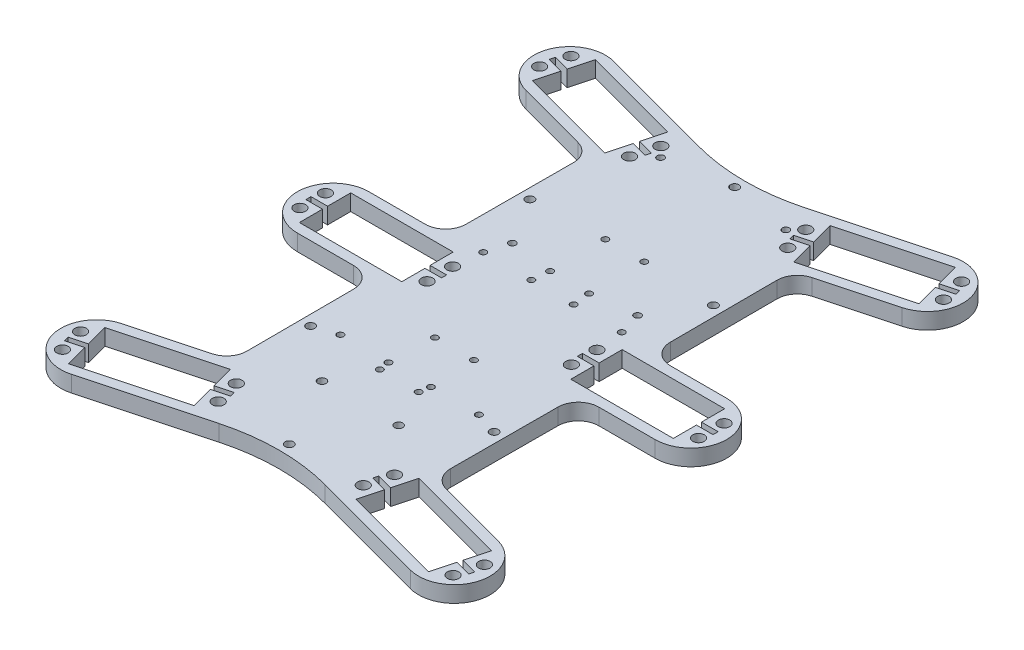
from build123d import *

# Parameters (mm, degrees)
SKETCH1_R           = 2.25
SKETCH1_W           = 40.1
SKETCH1_H           = 20.1
BOSS_EXTRUDE1_DEPTH = 6.35
FILLET1_R           = 80
FILLET2_R           = 8
SKETCH5_W           = 6.5
SKETCH5_H           = 2
CUT_EXTRUDE2_DEPTH  = 136.852736293
SKETCH6_R           = 1.25
SKETCH6_R_2         = 1.35
CUT_EXTRUDE3_DEPTH  = 10
SKETCH7_R           = 1.25
CUT_EXTRUDE4_DEPTH  = 10
SKETCH8_R           = 1.6
CUT_EXTRUDE5_DEPTH  = 10
SKETCH10_R          = 1.65
CUT_EXTRUDE6_DEPTH  = 10


with BuildPart() as part:
    # Sketch1 → Boss-Extrude1 (new body)
    with BuildSketch(Plane(origin=(0, 0, 0), x_dir=(1, 0, 0), z_dir=(0, 1, 0))):
        with BuildLine():
            Line((-70, 14), (-40, 14))
            Line((-40, 14), (-39.816062711, 70))
            Line((-39.816062711, 70), (-73.623466631, 79.058666579))
            ThreePointArc((-73.623466631, 79.058666579), (-83.522961568, 96.205094778), (-66.376533369, 106.104589715))
            Line((-66.376533369, 106.104589715), (0, 88.319051202))
            Line((0, 88.319051202), (66.376533369, 106.104589715))
            ThreePointArc((66.376533369, 106.104589715), (83.522961568, 96.205094778), (73.623466631, 79.058666579))
            Line((73.623466631, 79.058666579), (39.816062711, 70))
            Line((39.816062711, 70), (40, 14))
            Line((40, 14), (70, 14))
            ThreePointArc((70, 14), (84, 0), (70, -14))
            Line((70, -14), (40, -14))
            Line((40, -14), (39.816062711, -70))
            Line((39.816062711, -70), (73.623466631, -79.058666579))
            ThreePointArc((73.623466631, -79.058666579), (83.522961568, -96.205094778), (66.376533369, -106.104589715))
            Line((66.376533369, -106.104589715), (0, -88.319051202))
            Line((0, -88.319051202), (-66.376533369, -106.104589715))
            ThreePointArc((-66.376533369, -106.104589715), (-83.522961568, -96.205094778), (-73.623466631, -79.058666579))
            Line((-73.623466631, -79.058666579), (-39.816062711, -70))
            Line((-39.816062711, -70), (-40, -14))
            Line((-40, -14), (-70, -14))
            ThreePointArc((-70, -14), (-84, 0), (-70, 14))
        make_face()
        with Locations((-76.433311385, 99.481809639)):
            Circle(SKETCH1_R, mode=Mode.SUBTRACT)
        with Locations((-79.021501836, 89.822551376)):
            Circle(SKETCH1_R, mode=Mode.SUBTRACT)
        with Locations((-78, 5)):
            Circle(SKETCH1_R, mode=Mode.SUBTRACT)
        with Locations((-79.021501836, -89.822551376)):
            Circle(SKETCH1_R, mode=Mode.SUBTRACT)
        with Locations((-76.433311385, -99.481809639)):
            Circle(SKETCH1_R, mode=Mode.SUBTRACT)
        with Locations((-78, -5)):
            Circle(SKETCH1_R, mode=Mode.SUBTRACT)
        with Locations((78, -5)):
            Circle(SKETCH1_R, mode=Mode.SUBTRACT)
        with Locations((76.433311385, -99.481809639)):
            Circle(SKETCH1_R, mode=Mode.SUBTRACT)
        with Locations((79.021501836, -89.822551376)):
            Circle(SKETCH1_R, mode=Mode.SUBTRACT)
        with Locations((78, 5)):
            Circle(SKETCH1_R, mode=Mode.SUBTRACT)
        with Locations((79.021501836, 89.822551376)):
            Circle(SKETCH1_R, mode=Mode.SUBTRACT)
        with Locations((76.433311385, 99.481809639)):
            Circle(SKETCH1_R, mode=Mode.SUBTRACT)
        with Locations((-30.95703272, 76.943715692)):
            Circle(SKETCH1_R, mode=Mode.SUBTRACT)
        with Locations((-28.368842269, 86.602973955)):
            Circle(SKETCH1_R, mode=Mode.SUBTRACT)
        with Locations((-28.24, -5)):
            Circle(SKETCH1_R, mode=Mode.SUBTRACT)
        with Locations((-28.24, 5)):
            Circle(SKETCH1_R, mode=Mode.SUBTRACT)
        with Locations((-28.368842269, -86.602973955)):
            Circle(SKETCH1_R, mode=Mode.SUBTRACT)
        with Locations((-30.95703272, -76.943715692)):
            Circle(SKETCH1_R, mode=Mode.SUBTRACT)
        with Locations((28.368842269, 86.602973955)):
            Circle(SKETCH1_R, mode=Mode.SUBTRACT)
        with Locations((30.95703272, 76.943715692)):
            Circle(SKETCH1_R, mode=Mode.SUBTRACT)
        with Locations((28.24, 5)):
            Circle(SKETCH1_R, mode=Mode.SUBTRACT)
        with Locations((28.24, -5)):
            Circle(SKETCH1_R, mode=Mode.SUBTRACT)
        with Locations((30.95703272, -76.943715692)):
            Circle(SKETCH1_R, mode=Mode.SUBTRACT)
        with Locations((28.368842269, -86.602973955)):
            Circle(SKETCH1_R, mode=Mode.SUBTRACT)
        Polygon((-70.460853466, 103.109639074), (-75.663116273, 83.694529965), (-36.929490638, 73.315886257), (-31.727227832, 92.730995365), align=None, mode=Mode.SUBTRACT)
        with Locations((-53.12, 0)):
            Rectangle(SKETCH1_W, SKETCH1_H, mode=Mode.SUBTRACT)
        Polygon((-36.929490638, -73.315886257), (-31.727227832, -92.730995365), (-70.460853466, -103.109639074), (-75.663116273, -83.694529965), align=None, mode=Mode.SUBTRACT)
        Polygon((36.929490638, 73.315886257), (31.727227832, 92.730995365), (70.460853466, 103.109639074), (75.663116273, 83.694529965), align=None, mode=Mode.SUBTRACT)
        with Locations((53.12, 0)):
            Rectangle(SKETCH1_W, SKETCH1_H, mode=Mode.SUBTRACT)
        Polygon((36.929490638, -73.315886257), (31.727227832, -92.730995365), (70.460853466, -103.109639074), (75.663116273, -83.694529965), align=None, mode=Mode.SUBTRACT)
    extrude(amount=BOSS_EXTRUDE1_DEPTH)

    # Fillet1
    fillet1_edges = [part.edges().sort_by_distance(p)[0] for p in [
        (0, 3.175, -88.319051202),
        (0, 3.175, 88.319051202),
    ]]
    fillet(fillet1_edges, radius=FILLET1_R)

    # Fillet2
    fillet2_edges = [part.edges().sort_by_distance(p)[0] for p in [
        (39.816062711, 3.175, 70),
        (40, 3.175, 14),
        (40, 3.175, -14),
        (39.816062711, 3.175, -70),
        (-39.816062711, 3.175, -70),
        (-40, 3.175, -14),
        (-40, 3.175, 14),
        (-39.816062711, 3.175, 70),
    ]]
    fillet(fillet2_edges, radius=FILLET2_R)

    # Sketch5 → Cut-Extrude2 (cut, through all)
    with BuildSketch(Plane(origin=(0, 6.35, 0), x_dir=(1, 0, 0), z_dir=(0, 1, 0))):
        with Locations((-29.82, 0)):
            Rectangle(SKETCH5_W, SKETCH5_H)
        with Locations((-76.42, 0)):
            Rectangle(SKETCH5_W, SKETCH5_H)
        Polygon((-34.06954019, 83.989366637), (-27.791022319, 82.307042844), (-28.308660409, 80.375191192), (-34.58717828, 82.057514985), align=None)
        Polygon((-72.803165824, 94.368010346), (-73.320803914, 92.436158693), (-79.599321785, 94.118482486), (-79.081683695, 96.050334139), align=None)
        Polygon((72.803165824, 94.368010346), (79.081683695, 96.050334139), (79.599321785, 94.118482486), (73.320803914, 92.436158693), align=None)
        Polygon((34.06954019, 83.989366637), (34.58717828, 82.057514985), (28.308660409, 80.375191192), (27.791022319, 82.307042844), align=None)
        with Locations((76.42, 0)):
            Rectangle(SKETCH5_W, SKETCH5_H)
        with Locations((29.82, 0)):
            Rectangle(SKETCH5_W, SKETCH5_H)
        Polygon((34.06954019, -83.989366637), (27.791022319, -82.307042844), (28.308660409, -80.375191192), (34.58717828, -82.057514985), align=None)
        Polygon((72.803165824, -94.368010346), (73.320803914, -92.436158693), (79.599321785, -94.118482486), (79.081683695, -96.050334139), align=None)
        Polygon((-72.803165824, -94.368010346), (-79.081683695, -96.050334139), (-79.599321785, -94.118482486), (-73.320803914, -92.436158693), align=None)
        Polygon((-34.06954019, -83.989366637), (-34.58717828, -82.057514985), (-28.308660409, -80.375191192), (-27.791022319, -82.307042844), align=None)
    extrude(amount=-CUT_EXTRUDE2_DEPTH, mode=Mode.SUBTRACT)

    # Sketch6 → Cut-Extrude3 (cut)
    with BuildSketch(Plane(origin=(0, 6.35, 0), x_dir=(1, 0, 0), z_dir=(0, 1, 0))):
        with Locations((27.1, -40.058854365)):
            Circle(SKETCH6_R)
        with Locations((8.3, -40.058854365)):
            Circle(SKETCH6_R)
        with Locations((-8.3, -40.058854365)):
            Circle(SKETCH6_R)
        with Locations((-27.1, -40.058854365)):
            Circle(SKETCH6_R)
        with Locations((27.1, 15.841145635)):
            Circle(SKETCH6_R)
        with Locations((-8.3, 15.841145635)):
            Circle(SKETCH6_R)
        with Locations((-27.1, 15.841145635)):
            Circle(SKETCH6_R)
        with Locations((-24.5, 24.641145635)):
            Circle(SKETCH6_R_2)
        with Locations((24.5, 24.641145635)):
            Circle(SKETCH6_R_2)
        with Locations((24.5, 82.641145635)):
            Circle(SKETCH6_R_2)
        with Locations((-24.5, 82.641145635)):
            Circle(SKETCH6_R_2)
        with Locations((8.3, 15.841145635)):
            Circle(SKETCH6_R)
    extrude(amount=-CUT_EXTRUDE3_DEPTH, mode=Mode.SUBTRACT)

    # Sketch7 → Cut-Extrude4 (cut)
    with BuildSketch(Plane.XZ):
        with Locations((-7.62, 44.13)):
            Circle(SKETCH7_R)
        with Locations((7.62, 44.13)):
            Circle(SKETCH7_R)
        with Locations((7.62, 22.54)):
            Circle(SKETCH7_R)
        with Locations((-7.62, 22.54)):
            Circle(SKETCH7_R)
        with Locations((7.62, -22.54)):
            Circle(SKETCH7_R)
        with Locations((7.62, -44.13)):
            Circle(SKETCH7_R)
        with Locations((-7.62, -22.54)):
            Circle(SKETCH7_R)
        with Locations((-7.62, -44.13)):
            Circle(SKETCH7_R)
    extrude(amount=-CUT_EXTRUDE4_DEPTH, mode=Mode.SUBTRACT)

    # Sketch8 → Cut-Extrude5 (cut)
    with BuildSketch(Plane(origin=(0, 6.35, 0), x_dir=(1, 0, 0), z_dir=(0, 1, 0))):
        with Locations((15, -59.358854365)):
            Circle(SKETCH8_R)
        with Locations((-15, -59.358854365)):
            Circle(SKETCH8_R)
    extrude(amount=-CUT_EXTRUDE5_DEPTH, mode=Mode.SUBTRACT)

    # Sketch10 → Cut-Extrude6 (cut)
    with BuildSketch(Plane(origin=(0, 6.35, 0), x_dir=(1, 0, 0), z_dir=(0, 1, 0))):
        with Locations((-35.905030257, 42.907120147)):
            Circle(SKETCH10_R)
        with Locations((0, 87.141145635)):
            Circle(SKETCH10_R)
        with Locations((35.905030257, 42.907120147)):
            Circle(SKETCH10_R)
        with Locations((35.905030257, -42.907120147)):
            Circle(SKETCH10_R)
        with Locations((-35.905030257, -42.907120147)):
            Circle(SKETCH10_R)
        with Locations((0, -87.141145635)):
            Circle(SKETCH10_R)
    extrude(amount=-CUT_EXTRUDE6_DEPTH, mode=Mode.SUBTRACT)


solid = part.part
